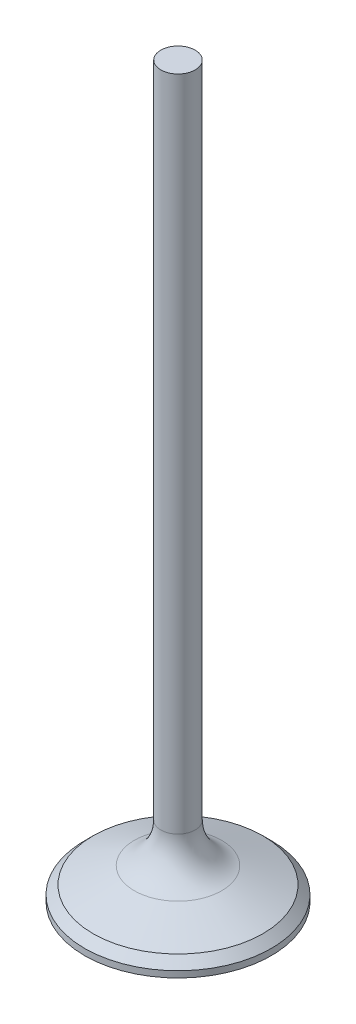
from build123d import *


with BuildPart() as part:
    # Sketch1 → Revolve1 (revolve)
    with BuildSketch(Plane.XY):
        with BuildLine():
            Line((0, 0), (14.85, 0))
            Line((14.85, 0), (14.85, 1))
            Line((14.85, 1), (13.5, 2.35))
            Line((13.5, 2.35), (6.951405494, 4.995803923))
            ThreePointArc((6.951405494, 4.995803923), (3.883996385, 7.479742843), (2.73, 11.254294941))
            Line((2.73, 11.254294941), (2.73, 115.95))
            Line((2.73, 115.95), (0, 115.95))
            Line((0, 115.95), (0, 0))
        make_face()
    revolve(axis=Axis((0, 0, 0), (0, 1, 0)))


solid = part.part
